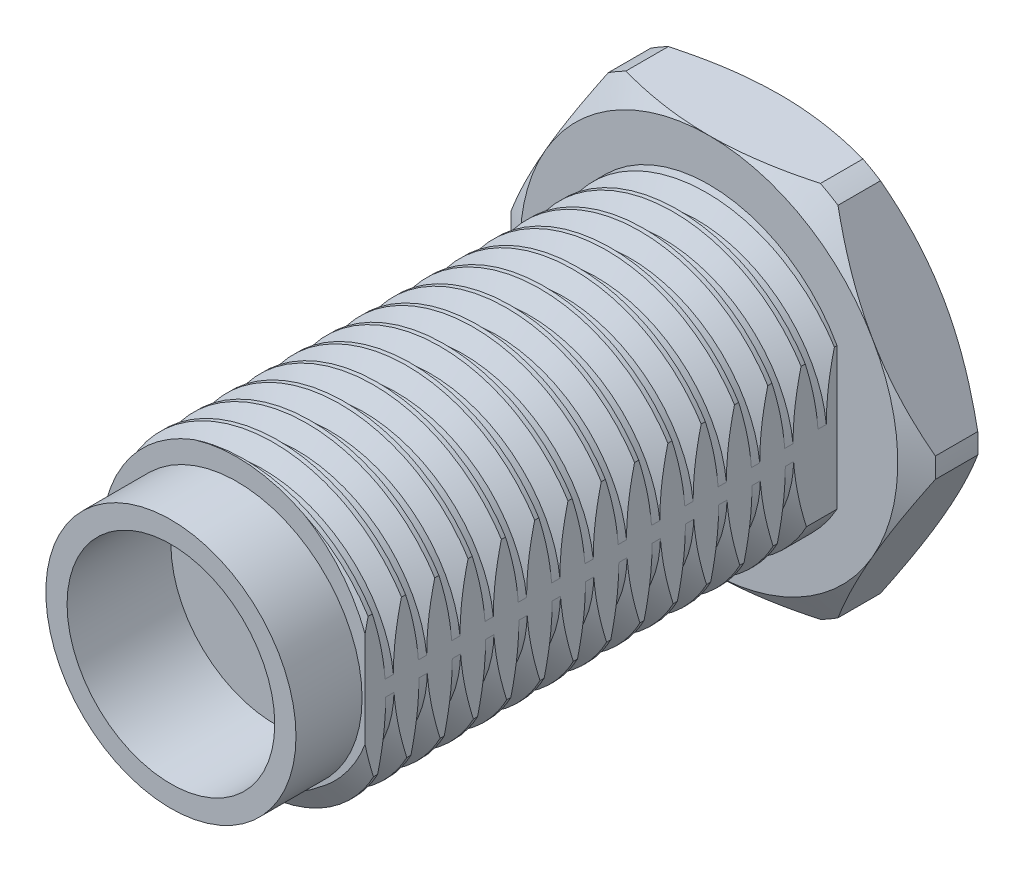
from build123d import *

# Parameters (mm, degrees)
BOSS_EXTRUDE1_DEPTH = 1.5
SKETCH1_3_R         = 2.2
BOSS_EXTRUDE2_DEPTH = 12.9
SKETCH1_4_R         = 2.2
SKETCH1_4_R_2       = 0.95
SKETCH1_4_R_3       = 0.6
BOSS_EXTRUDE3_DEPTH = 10.7
BOSS_EXTRUDE4_START = -1.1
SKETCH1_5_R         = 0.6
SKETCH1_5_R_2       = 0.5
SKETCH1_5_R_3       = 0.25
BOSS_EXTRUDE4_DEPTH = 1.1
SKETCH2_R           = 3.5
SKETCH2_R_2         = 2.65
CUT_EXTRUDE1_DEPTH  = 1.4
THREAD1_PITCH       = 0.705555556
SKETCH1_6_R         = 0.6
SKETCH1_6_R_2       = 0.5
BOSS_EXTRUDE5_DEPTH = 10.7


with BuildPart() as part:
    # Sketch1 → Boss-Extrude1 (new body)
    with BuildSketch(Plane.XY):
        with BuildLine():
            ThreePointArc((-2.061552813, 4), (-2.25, 3.897114317), (-2.433325209, 3.785357107))
            Line((-2.433325209, 3.785357107), (-4.494878022, 0.214642893))
            ThreePointArc((-4.494878022, 0.214642893), (-4.5, 0), (-4.494878022, -0.214642893))
            Line((-4.494878022, -0.214642893), (-2.433325209, -3.785357107))
            ThreePointArc((-2.433325209, -3.785357107), (-2.25, -3.897114317), (-2.061552813, -4))
            Line((-2.061552813, -4), (2.061552813, -4))
            ThreePointArc((2.061552813, -4), (2.25, -3.897114317), (2.433325209, -3.785357107))
            Line((2.433325209, -3.785357107), (4.494878022, -0.214642893))
            ThreePointArc((4.494878022, -0.214642893), (4.5, 0), (4.494878022, 0.214642893))
            Line((4.494878022, 0.214642893), (2.433325209, 3.785357107))
            ThreePointArc((2.433325209, 3.785357107), (2.25, 3.897114317), (2.061552813, 4))
            Line((2.061552813, 4), (-2.061552813, 4))
        make_face()
    extrude(amount=BOSS_EXTRUDE1_DEPTH)

    # Sketch1<3> → Boss-Extrude2 (add)
    with BuildSketch(Plane.XY):
        with BuildLine():
            Line((2.712931993, 1.5), (2.712931993, -1.5))
            ThreePointArc((2.712931993, -1.5), (-3.1, 0), (2.712931993, 1.5))
        make_face()
        with Locations(Location((0, 0, 0), (0, 0, 180))):
            Circle(SKETCH1_3_R, mode=Mode.SUBTRACT)
    extrude(amount=BOSS_EXTRUDE2_DEPTH)

    # Sketch1<4> → Boss-Extrude3 (add)
    # profile 1 of 2: a face of its own
    with BuildSketch(Plane.XY):
        with Locations(Location((0, 0, 0), (0, 0, 180))):
            Circle(SKETCH1_4_R)
        Circle(SKETCH1_4_R_2, mode=Mode.SUBTRACT)
    # profile 2 of 2: a face of its own
    with BuildSketch(Plane.XY):
        Circle(SKETCH1_4_R_2)
        Circle(SKETCH1_4_R_3, mode=Mode.SUBTRACT)
    extrude(amount=BOSS_EXTRUDE3_DEPTH)

    # Sketch1<5> → Boss-Extrude4 (add)
    # profile 1 of 2: a face of its own
    with BuildSketch(Plane.XY.offset(BOSS_EXTRUDE4_START)):
        Circle(SKETCH1_5_R)
        Circle(SKETCH1_5_R_2, mode=Mode.SUBTRACT)
    # profile 2 of 2: a face of its own
    with BuildSketch(Plane.XY.offset(BOSS_EXTRUDE4_START)):
        Circle(SKETCH1_5_R_3)
    extrude(amount=BOSS_EXTRUDE4_DEPTH)

    # Sketch2 → Cut-Extrude1 (cut)
    with BuildSketch(Plane.XY.offset(12.9)):
        Circle(SKETCH2_R)
        Circle(SKETCH2_R_2, mode=Mode.SUBTRACT)
    extrude(amount=-CUT_EXTRUDE1_DEPTH, mode=Mode.SUBTRACT)

    # Thread1: the profile of Thread Profile2 profile screwed along a right-hand helix of 16.15748 turns, 6 arcs to a turn; built about Z, then put on its axis
    thread1_z = Axis((0, 0, 0), (0, 0, 1))
    thread1_corners = [(3.1003, 0, -0.000173205), (3.1003, 0, 0.617534314), (2.718106855, 0, 0.396874999), (2.718106855, 0, 0.22048611)]
    with BuildLine(mode=Mode.PRIVATE) as thread1_profile:
        Line(thread1_corners[0], thread1_corners[1])
        Line(thread1_corners[1], thread1_corners[2])
        Line(thread1_corners[2], thread1_corners[3])
        Line(thread1_corners[3], thread1_corners[0])
    thread1_cap = Face(thread1_profile.wire())
    thread1_turn_angles = [0, 30, 60, 90, 120, 150, 180, 210, 240, 270, 300, 330, 360]
    thread1_turn_weights = [1, 0.8660254037844387, 1, 0.8660254037844387, 1, 0.8660254037844387, 1, 0.8660254037844387, 1, 0.8660254037844387, 1, 0.8660254037844387, 1]
    thread1_turn_rails = [Edge.make_bspline([Vector(p[0], p[1], 0).rotate(thread1_z, thread1_turn_angles[k]) / thread1_turn_weights[k] + Vector(0, 0, p[2] + THREAD1_PITCH * thread1_turn_angles[k] / 360) for k in range(13)], [0, 0, 0, 1, 1, 2, 2, 3, 3, 4, 4, 5, 5, 6, 6, 6], 2, thread1_turn_weights) for p in thread1_corners]
    thread1_turn_sides = [Face.make_surface_from_curves(thread1_turn_rails[p[0]], thread1_turn_rails[p[1]]) for p in [(0, 1), (1, 2), (2, 3), (3, 0)]]
    thread1_last_angles = [5760, 5788.346456693, 5816.692913386]
    thread1_last_weights = [1, 0.8800926628551853, 1]
    thread1_last_rails = [Edge.make_bspline([Vector(p[0], p[1], 0).rotate(thread1_z, thread1_last_angles[k]) / thread1_last_weights[k] + Vector(0, 0, p[2] + THREAD1_PITCH * thread1_last_angles[k] / 360) for k in range(3)], [0, 0, 0, 1, 1, 1], 2, thread1_last_weights) for p in thread1_corners]
    thread1_last_sides = [Face.make_surface_from_curves(thread1_last_rails[p[0]], thread1_last_rails[p[1]]) for p in [(0, 1), (1, 2), (2, 3), (3, 0)]]
    thread1 = Plane(origin=(0, 0, 1.5), x_dir=(1, 0, 0), z_dir=(0, 0, 1)) * Solid(Shell([*[p.moved(Location((0, 0, THREAD1_PITCH * i))) for i in range(16) for p in thread1_turn_sides], *thread1_last_sides, thread1_cap, thread1_cap.rotate(thread1_z, 5816.692913386).moved(Location((0, 0, THREAD1_PITCH * 5816.692913386 / 360)))]))
    add(thread1, mode=Mode.SUBTRACT)

    # Sketch10 → Cut-Revolve1 (revolve, cut)
    with BuildSketch(Plane(origin=(0, 0, 0), x_dir=(1, 0, 0), z_dir=(0, 1, 0)), mode=Mode.PRIVATE) as cut_revolve1_sk:
        Polygon((-4, 0), (-4.5, 0), (-4.5, -0.3), align=None)
        Polygon((-4, -1.5), (-4.5, -1.5), (-4.5, -1.2), align=None)
        with BuildLine():
            Line((-0.25, 1.1), (-0.25, 0.88))
            ThreePointArc((-0.25, 0.88), (-0.185563492, 1.035563492), (-0.03, 1.1))
            Line((-0.03, 1.1), (-0.25, 1.1))
        make_face()
    revolve(cut_revolve1_sk.sketch.rotate(Axis((0, 0, -1.882254333), (0, 0, 1)), 180), axis=Axis((0, 0, -1.882254333), (0, 0, 1)), mode=Mode.SUBTRACT)


with BuildPart() as body_2:
    # Sketch1<6> → Boss-Extrude5 (new body)
    with BuildSketch(Plane.XY):
        Circle(SKETCH1_6_R)
        Circle(SKETCH1_6_R_2, mode=Mode.SUBTRACT)
    extrude(amount=BOSS_EXTRUDE5_DEPTH)


solid = Compound([part.part, body_2.part])
